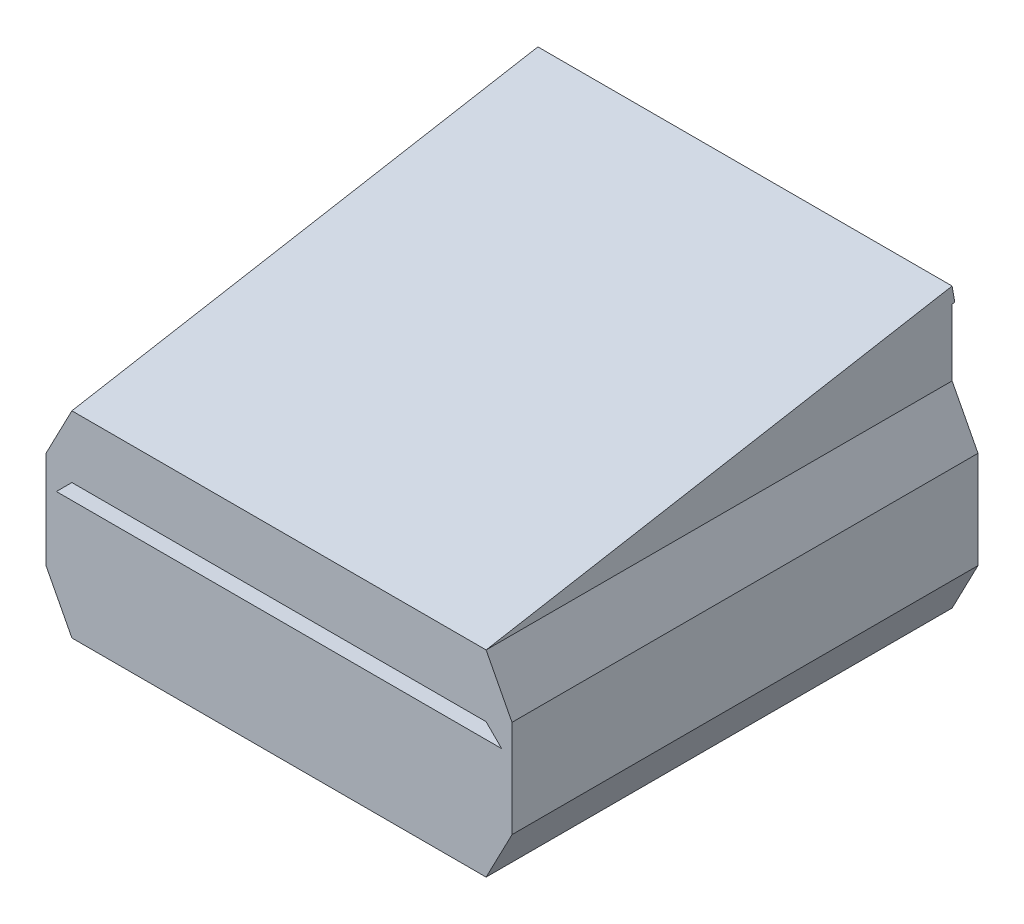
from build123d import *

# Parameters (mm, degrees)
SKETCH1_W                      = 80
SKETCH1_H                      = 90
BOSS_EXTRUDE1_BASE_DEPTH       = 3
BOSS_EXTRUDE4_SIDE_WALLS_DEPTH = 90
CUT_EXTRUDE2_GUIDE_HOLES_DEPTH = 130.495173655
SKETCH15_W                     = 80
SKETCH15_H                     = 20
BOSS_EXTRUDE9_REAR_WALL_DEPTH  = 3
BOSS_EXTRUDE1_START            = 3
SKETCH17_W                     = 80
SKETCH17_H                     = 3
BOSS_EXTRUDE1_DEPTH            = 12
BOSS_EXTRUDE2_START            = 23
SKETCH20_W                     = 3
SKETCH20_H                     = 87
BOSS_EXTRUDE2_DEPTH            = 12
CHAMFER1_SIZE                  = 3
BOSS_EXTRUDE5_DEPTH            = 30
CHAMFER2_SIZE                  = 170.138454589
CHAMFER2_SIZE_2                = 30
SKETCH27_W                     = 80
SKETCH27_H                     = 91.38839507
BOSS_EXTRUDE6_DEPTH            = 3


# Some blends are built 0.0001 mm under size
with BuildPart() as part:
    # Sketch1 → Boss-Extrude1 _Base (new body)
    with BuildSketch(Plane(origin=(0, 0, 0), x_dir=(1, 0, 0), z_dir=(0, 1, 0))):
        with Locations((40, 45)):
            Rectangle(SKETCH1_W, SKETCH1_H)
    extrude(amount=BOSS_EXTRUDE1_BASE_DEPTH)

    # Sketch5 → Boss-Extrude4 _Side Walls (add, through all)
    with BuildSketch(Plane.XY):
        Polygon((-5, 28.390936655), (0, 38), (0, 0), (-5, 9.609063345), align=None)
        Polygon((85, 9.609063345), (85, 28.390936655), (80, 38), (80, 0), align=None)
    extrude(amount=-BOSS_EXTRUDE4_SIDE_WALLS_DEPTH)

    # Sketch4 → Cut-Extrude2 _Guide Holes (cut, through all)
    with BuildSketch(Plane.XY):
        Polygon((-3, 23), (0, 26), (0, 23), align=None)
        Polygon((80, 23), (83, 23), (80, 26), align=None)
    extrude(amount=-CUT_EXTRUDE2_GUIDE_HOLES_DEPTH, mode=Mode.SUBTRACT)

    # Sketch15 → Boss-Extrude9 _Rear Wall (add)
    with BuildSketch(Plane.XY):
        with Locations((40, 13)):
            Rectangle(SKETCH15_W, SKETCH15_H)
    extrude(amount=-BOSS_EXTRUDE9_REAR_WALL_DEPTH)

    # Sketch17 → Boss-Extrude1 (add)
    with BuildSketch(Plane(origin=(0, 23, 0), x_dir=(1, 0, 0), z_dir=(0, 1, 0)).offset(BOSS_EXTRUDE1_START)):
        with Locations((40, 1.5)):
            Rectangle(SKETCH17_W, SKETCH17_H)
    extrude(amount=BOSS_EXTRUDE1_DEPTH)

    # Sketch20 → Boss-Extrude2 (add)
    with BuildSketch(Plane(origin=(0, 3, 0), x_dir=(1, 0, 0), z_dir=(0, 1, 0)).offset(BOSS_EXTRUDE2_START)):
        with Locations((1.5, 46.5)):
            Rectangle(SKETCH20_W, SKETCH20_H)
        with Locations((78.5, 46.5)):
            Rectangle(SKETCH20_W, SKETCH20_H)
    extrude(amount=BOSS_EXTRUDE2_DEPTH)

    # Chamfer1
    chamfer1_edges = [part.edges().sort_by_distance(p)[0] for p in [
        (77, 26, -46.5),
        (3, 26, -46.5),
    ]]
    chamfer(chamfer1_edges, length=CHAMFER1_SIZE - 0.0001)  # a hair under: the kernel refuses the full size

    # Sketch26 → Boss-Extrude5 (add)
    with BuildSketch(Plane(origin=(0, 38, 0), x_dir=(1, 0, 0), z_dir=(0, 1, 0))):
        Polygon((77, 90), (80, 90), (80, 0), (0, 0), (0, 90), (3, 90), (3, 3), (77, 3), align=None)
    extrude(amount=BOSS_EXTRUDE5_DEPTH)

    # Chamfer2
    # the kernel refuses this chamfer: 170.138454589, 30 mm, written as the material it takes off along each edge
    with BuildSketch(Plane(origin=(522.111375011, 68, 0), x_dir=(0, 0.0066825316561015475, -0.9999776716360548), z_dir=(-1, 0, 0))) as chamfer2_piece_1:
        Polygon((CHAMFER2_SIZE * 0.999977671633, CHAMFER2_SIZE * 0.00668253165608), (-CHAMFER2_SIZE_2 * 0.0066825316561, CHAMFER2_SIZE_2 * 0.999977671636), (0, 0), align=None)
    extrude(amount=964.222750023, mode=Mode.SUBTRACT)

    # Sketch27 → Boss-Extrude6 (add)
    with BuildSketch(Plane(origin=(0, 36.854159795, 6.498382723), x_dir=(1, 0, 0), z_dir=(0, 0.9848077530122086, 0.17364817766692742))):
        with Locations((40, 52.292828286)):
            Rectangle(SKETCH27_W, SKETCH27_H)
    extrude(amount=-BOSS_EXTRUDE6_DEPTH)


solid = part.part
